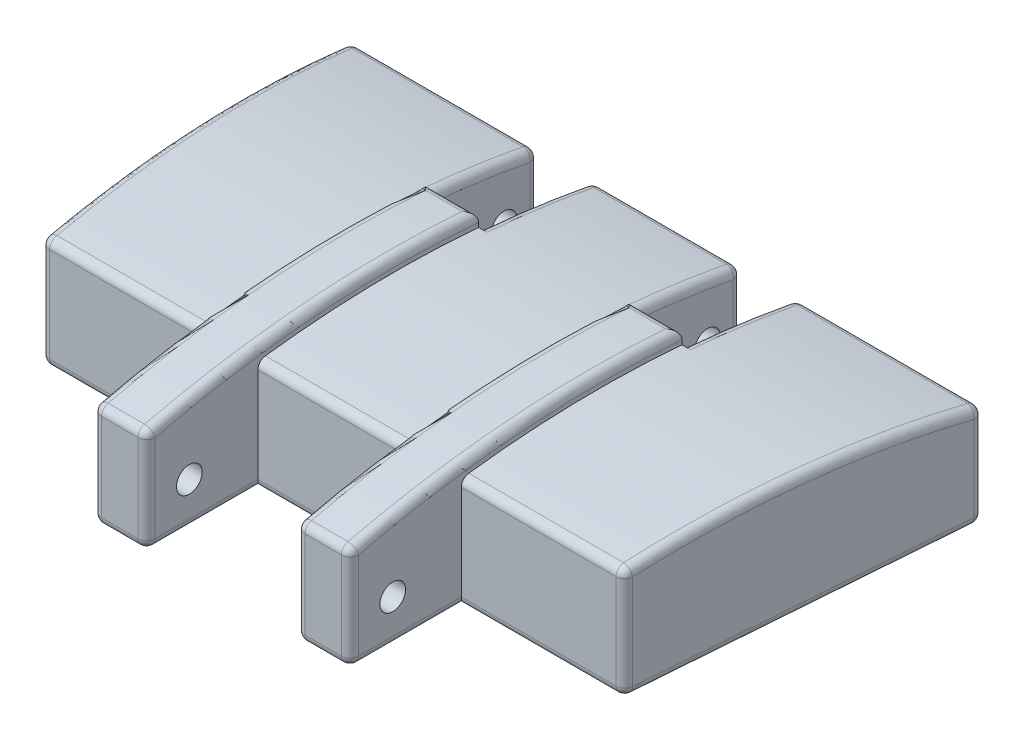
from build123d import *

# Parameters (mm, degrees)
EXTRUDE1_DEPTH                            = 3.556
EXTRUDE3_DEPTH                            = 17.595746564
EXTRUDE3_DEPTH_BACK                       = 17.595746564
SKETCH3_W                                 = 1.5875
SKETCH3_H                                 = 9.846674306
EXTRUDE10_DEPTH                           = 3.937
SURFACECUT2_START                         = -3.81
SURFACECUT2_DEPTH                         = 7.62
EXTRUDE11_REACH                           = 19.19
EXTRUDE11_OFFSET_FROM_SURFACE             = 0.508
SKETCH4_R                                 = 0.381
EXTRUDE11_DIRECTION_2_REACH               = 19.19
EXTRUDE11_DIRECTION_2_OFFSET_FROM_SURFACE = 0.508
EXTRUDE12_DEPTH                           = 17.681535811
EXTRUDE12_DEPTH_BACK                      = 17.681535811
SKETCH6_R                                 = 0.381
FILLET1_R                                 = 0.254


# Read off the part's stored shape, not the designer's step: SurfaceCut2
with BuildPart() as part:
    # Sketch1 → Extrude1 (new body)
    with BuildSketch(Plane(origin=(0, 0, 0), x_dir=(1, 0, 0), z_dir=(0, 1, 0))):
        Polygon((-9.398, 13.208), (-3.81, 13.208), (-3.81, 9.846674306), (-2.2225, 9.846674306), (-2.2225, 13.208), (2.2225, 13.208), (2.2225, 9.846674306), (3.81, 9.846674306), (3.81, 13.208), (9.398, 13.208), (8.636, 3.302), (3.81, 3.302), (3.81, 0), (2.2225, 0), (2.2225, 3.302), (-2.2225, 3.302), (-2.2225, 0), (-3.81, 0), (-3.81, 3.302), (-8.636, 3.302), align=None)
    extrude(amount=EXTRUDE1_DEPTH)

    # Sketch2 → Extrude3 (cut, two sides: drawn at the far end of the back side and taken through both)
    with BuildSketch(Plane(origin=(0, 0, 0), x_dir=(0, 0, -1), z_dir=(1, 0, 0)).offset(-EXTRUDE3_DEPTH_BACK)):
        with BuildLine():
            Line((49.598643064, -4.145643534), (13.208, 2.986890873))
            ThreePointArc((13.208, 2.986890873), (6.585946144, 3.5465348), (0, 2.657652358))
            Line((0, 2.657652358), (-35.990079894, -6.279131118))
            Line((-35.990079894, -6.279131118), (-37.838258878, 67.863920028))
            Line((-37.838258878, 67.863920028), (47.75046408, 69.997407612))
            Line((47.75046408, 69.997407612), (49.598643064, -4.145643534))
        make_face()
    extrude(amount=EXTRUDE3_DEPTH + EXTRUDE3_DEPTH_BACK, mode=Mode.SUBTRACT)

    # Sketch3 → Extrude10 (add)
    with BuildSketch(Plane(origin=(0, 0, 0), x_dir=(1, 0, 0), z_dir=(0, 1, 0))):
        with Locations((-3.01625, 4.923337153)):
            Rectangle(SKETCH3_W, SKETCH3_H)
    extrude10 = extrude(amount=EXTRUDE10_DEPTH)

    # Mirror1: Extrude10 across plane
    add(extrude10.mirror(Plane(origin=(0, 0, 0), x_dir=(0, 0, 1), z_dir=(1, 0, 0))))

    # SurfaceCut2 outline → SurfaceCut2 (cut)
    with BuildSketch(Plane.YZ.offset(SURFACECUT2_START)):
        with BuildLine():
            Line((3.937, 0), (3.050073418, 0))
            ThreePointArc((3.050073418, 0), (3.71446604, -3.646069851), (3.937, -7.345491636))
            Line((3.937, -7.345491636), (3.937, 0))
        make_face()
        with BuildLine():
            Line((3.937, -9.846674306), (3.937, -7.345491636))
            ThreePointArc((3.937, -7.345491636), (3.911608717, -8.597112758), (3.83547667, -9.846674306))
            Line((3.83547667, -9.846674306), (3.937, -9.846674306))
        make_face()
    extrude(amount=SURFACECUT2_DEPTH, mode=Mode.SUBTRACT)

    # Extrude11: up to this face of the body (flat: up to its plane, moved by the offset)
    extrude11_end = Plane(part.part.faces().sort_by_distance((-9.011444852, 1.707011117, -8.18278308))[0]).offset(-EXTRUDE11_OFFSET_FROM_SURFACE)
    # Sketch4 → Extrude11 (cut, up to the picked face)
    with BuildSketch(Plane(origin=(0, 0, 0), x_dir=(0, 0, -1), z_dir=(1, 0, 0)), mode=Mode.PRIVATE) as extrude11_sk1:
        with Locations(Location((12.192, 1.524, 0), (0, 0, 180))):
            Circle(SKETCH4_R)
    extrude11_tool1 = split(extrude(extrude11_sk1.sketch, amount=-EXTRUDE11_REACH, mode=Mode.PRIVATE), bisect_by=extrude11_end, keep=Keep.BOTH, mode=Mode.PRIVATE)
    add(extrude11_tool1.solids().sort_by(Axis((0, 1.524, -12.192), (-1, 0, 0)))[0], mode=Mode.SUBTRACT)

    # Extrude11 direction 2: up to this face of the body (flat: up to its plane, moved by the offset)
    extrude11_direction_2_end = Plane(part.part.faces().sort_by_distance((9.011444852, 1.707011117, -8.18278308))[0]).offset(-EXTRUDE11_DIRECTION_2_OFFSET_FROM_SURFACE)
    # Sketch4 → Extrude11 direction 2 (cut, up to the picked face)
    with BuildSketch(Plane(origin=(0, 0, 0), x_dir=(0, 0, -1), z_dir=(1, 0, 0)), mode=Mode.PRIVATE) as extrude11_direction_2_sk1:
        with Locations(Location((12.192, 1.524, 0), (0, 0, 180))):
            Circle(SKETCH4_R)
    extrude11_direction_2_tool1 = split(extrude(extrude11_direction_2_sk1.sketch, amount=EXTRUDE11_DIRECTION_2_REACH, mode=Mode.PRIVATE), bisect_by=extrude11_direction_2_end, keep=Keep.BOTH, mode=Mode.PRIVATE)
    add(extrude11_direction_2_tool1.solids().sort_by(Axis((0, 1.524, -12.192), (1, 0, 0)))[0], mode=Mode.SUBTRACT)

    # Sketch6 → Extrude12 (cut, two sides: drawn at the far end of the back side and taken through both)
    with BuildSketch(Plane(origin=(0, 0, 0), x_dir=(0, 0, -1), z_dir=(1, 0, 0)).offset(-EXTRUDE12_DEPTH_BACK)):
        with Locations((1.27, 1.27)):
            Circle(SKETCH6_R)
    extrude(amount=EXTRUDE12_DEPTH + EXTRUDE12_DEPTH_BACK, mode=Mode.SUBTRACT)

    # Fillet1
    fillet1_edges = [part.edges().sort_by_distance(p)[0] for p in [
        (-6.604, 0, -13.208),
        (-3.81, 1.493445436, -13.208),
        (-6.604, 2.986890873, -13.208),
        (-9.398, 1.493445436, -13.208),
        (-6.223, 0, -3.302),
        (-9.017, 0, -8.255),
        (-3.81, 0, -11.527337153),
        (-3.01625, 0, -9.846674306),
        (-2.2225, 0, -11.527337153),
        (0, 0, -13.208),
        (2.2225, 0, -11.527337153),
        (3.01625, 0, -9.846674306),
        (3.81, 0, -11.527337153),
        (6.604, 0, -13.208),
        (9.017, 0, -8.255),
        (6.223, 0, -3.302),
        (3.81, 0, -1.651),
        (3.01625, 0, 0),
        (2.2225, 0, -1.651),
        (0, 0, -3.302),
        (-2.2225, 0, -1.651),
        (-3.01625, 0, 0),
        (-3.81, 0, -1.651),
        (-3.81, 3.266862925, -11.533831851),
        (-9.173572685, 3.413396869, -10.290444907),
        (-8.791176137, 3.488578105, -5.319289775),
        (-6.223, 3.286603724, -3.302),
        (-8.636, 1.643301862, -3.302),
        (-3.01625, 3.83547667, -9.846674306),
        (-2.2225, 1.493445436, -13.208),
        (-2.2225, 3.266862925, -11.533831851),
        (2.2225, 1.493445436, -13.208),
        (0, 2.986890873, -13.208),
        (2.2225, 3.266862925, -11.533831851),
        (3.01625, 3.83547667, -9.846674306),
        (3.81, 1.493445436, -13.208),
        (3.81, 3.266862925, -11.533831851),
        (9.398, 1.493445436, -13.208),
        (6.604, 2.986890873, -13.208),
        (8.636, 1.643301862, -3.302),
        (8.791176137, 3.488578105, -5.319289775),
        (9.173572685, 3.413396869, -10.290444907),
        (6.223, 3.286603724, -3.302),
        (3.81, 1.525036709, 0),
        (3.81, 3.71446604, -3.64606985),
        (3.81, 3.911608717, -8.597112758),
        (2.2225, 1.525036709, 0),
        (3.01625, 3.050073418, 0),
        (2.2225, 3.71446604, -3.64606985),
        (2.2225, 3.911608717, -8.597112758),
        (0, 3.286603724, -3.302),
        (-2.2225, 1.525036709, 0),
        (-2.2225, 3.71446604, -3.64606985),
        (-2.2225, 3.911608717, -8.597112758),
        (-3.81, 1.525036709, 0),
        (-3.01625, 3.050073418, 0),
        (-3.81, 3.71446604, -3.64606985),
        (-3.81, 3.911608717, -8.597112758),
    ]]
    fillet(fillet1_edges, radius=FILLET1_R)


solid = part.part
